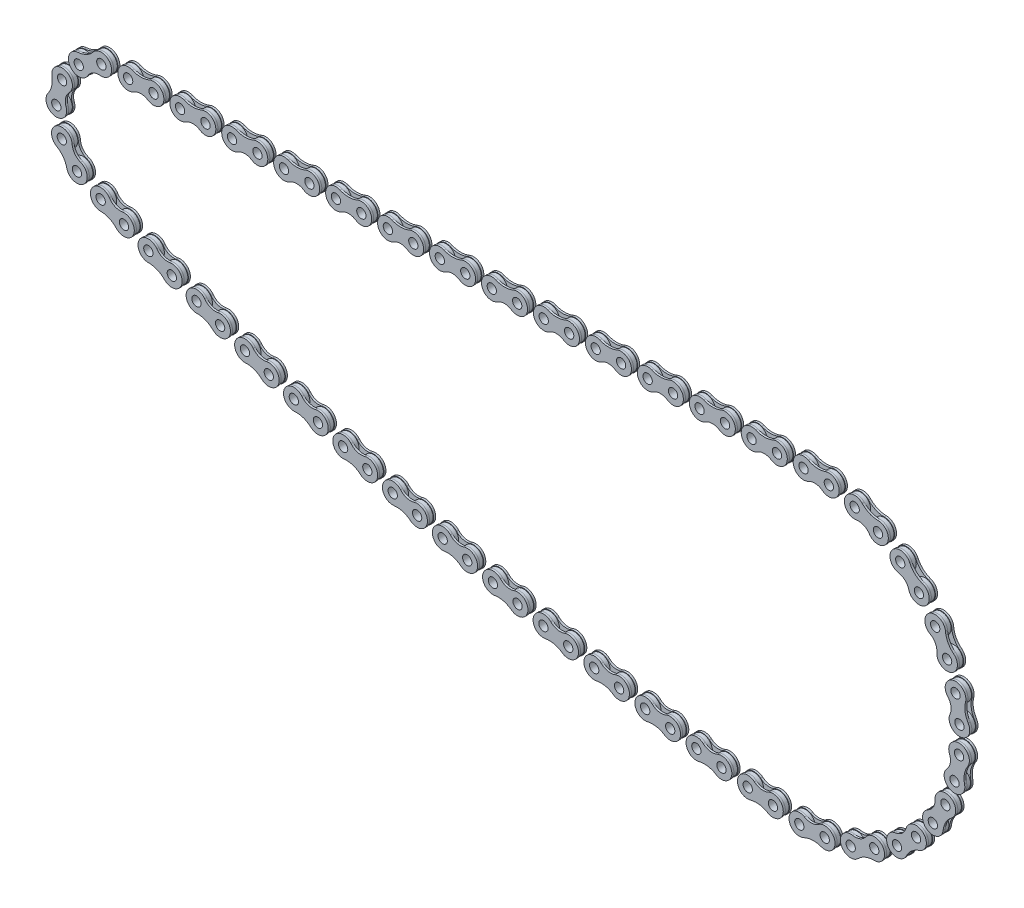
from build123d import *

# Parameters (mm, degrees)
SKETCH1_R             = 4.75
SKETCH1_R_2           = 2.25
BOSS_EXTRUDE1_DEPTH   = 1
BOSS_EXTRUDE1_2_DEPTH = 1
SKETCH3_R             = 2.25
BOSS_EXTRUDE2_DEPTH   = 1
CRVPATTERN1_5_ANGLE   = 4.3505813
CRVPATTERN1_6_ANGLE   = 23.555347
CRVPATTERN1_7_ANGLE   = 42.7601127
CRVPATTERN1_8_ANGLE   = 61.9648784
CRVPATTERN1_9_ANGLE   = 81.1696442
CRVPATTERN1_10_ANGLE  = 100.3744099
CRVPATTERN1_11_ANGLE  = 119.5791756
CRVPATTERN1_12_ANGLE  = 138.7839413
CRVPATTERN1_13_ANGLE  = 157.988707
CRVPATTERN1_14_ANGLE  = 177.1934727
CRVPATTERN1_15_ANGLE  = 172.4142473
CRVPATTERN1_16_ANGLE  = 171.1676379
CRVPATTERN1_17_ANGLE  = 169.9210285
CRVPATTERN1_18_ANGLE  = 168.6744191
CRVPATTERN1_19_ANGLE  = 167.4278097
CRVPATTERN1_20_ANGLE  = 166.1812003
CRVPATTERN1_21_ANGLE  = 164.9345909
CRVPATTERN1_22_ANGLE  = 163.6879815
CRVPATTERN1_23_ANGLE  = 162.4413721
CRVPATTERN1_24_ANGLE  = 161.1947627
CRVPATTERN1_25_ANGLE  = 159.9481533
CRVPATTERN1_26_ANGLE  = 158.7015439
CRVPATTERN1_27_ANGLE  = 157.4549345
CRVPATTERN1_28_ANGLE  = 156.2083251
CRVPATTERN1_29_ANGLE  = 126.4122141
CRVPATTERN1_30_ANGLE  = 76.9153953
CRVPATTERN1_31_ANGLE  = 27.4185764


with BuildPart() as part:
    # Sketch1 → Boss-Extrude1 (new, symmetric)
    with BuildSketch(Plane.XY):
        with Locations((-6.15, 0)):
            Circle(SKETCH1_R)
        with Locations((-6.15, 0)):
            Circle(SKETCH1_R_2, mode=Mode.SUBTRACT)
    extrude(amount=BOSS_EXTRUDE1_DEPTH, both=True)



with BuildPart() as body_2:
    # Sketch1 → Boss-Extrude1 2 (new, symmetric)
    with BuildSketch(Plane.XY):
        with Locations(Location((6.15, 0, 0), (0, 0, 180))):
            Circle(SKETCH1_R)
        with Locations((6.15, 0)):
            Circle(SKETCH1_R_2, mode=Mode.SUBTRACT)
    extrude(amount=BOSS_EXTRUDE1_2_DEPTH, both=True)


with BuildPart() as part_1:
    add(part.part)

    add(body_2.part)  # Boss-Extrude2 merges body 2
    # Sketch3 → Boss-Extrude2 (add)
    with BuildSketch(Plane.XY.offset(1)):
        with BuildLine():
            ThreePointArc((-4.174326828, 4.593116101), (-11.132529303, -0.41761435), (-3.437312133, -4.20015768))
            ThreePointArc((-3.437312133, -4.20015768), (0, -3.186658212), (3.437312133, -4.20015768))
            ThreePointArc((3.437312133, -4.20015768), (11.132529303, -0.41761435), (4.174326828, 4.593116101))
            ThreePointArc((4.174326828, 4.593116101), (0, 3.733426149), (-4.174326828, 4.593116101))
        make_face()
        with Locations((-6.15, 0)):
            Circle(SKETCH3_R, mode=Mode.SUBTRACT)
        with Locations((6.15, 0)):
            Circle(SKETCH3_R, mode=Mode.SUBTRACT)
    extrude(amount=BOSS_EXTRUDE2_DEPTH)

    # Mirror1: part across plane


with BuildPart() as part_2:
    add(part_1.part)
    add(part_1.part.mirror(Plane.XY))


with BuildPart() as body_2_2:
    # CrvPattern1: read off the stored shape, not the designer's step
    # CrvPattern1: copy of part
    add(part_2.part.moved(Location((25.1389795, 0, 0))))


with BuildPart() as body_3:
    # CrvPattern1 2: copy of part
    add(part_2.part.moved(Location((50.2779591, 0, 0))))


with BuildPart() as body_4:
    # CrvPattern1 3: copy of part
    add(part_2.part.moved(Location((75.4169386, 0, 0))))


with BuildPart() as body_5:
    # CrvPattern1 4: copy of part
    add(part_2.part.moved(Location((100.5559181, 0, 0))))


with BuildPart() as body_6:
    # CrvPattern1 5: copy of part
    add(part_2.part.moved(Location((125.3389364, 9.3190121, 0))).rotate(Axis((0, 0, 0), (0, 0, -1)), CRVPATTERN1_5_ANGLE))


with BuildPart() as body_7:
    # CrvPattern1 6: copy of part
    add(part_2.part.moved(Location((139.9486935, 54.2004048, 0))).rotate(Axis((0, 0, 0), (0, 0, -1)), CRVPATTERN1_6_ANGLE))


with BuildPart() as body_8:
    # CrvPattern1 7: copy of part
    add(part_2.part.moved(Location((138.9818847, 101.389913, 0))).rotate(Axis((0, 0, 0), (0, 0, -1)), CRVPATTERN1_7_ANGLE))


with BuildPart() as body_9:
    # CrvPattern1 8: copy of part
    add(part_2.part.moved(Location((122.5461177, 145.6352515, 0))).rotate(Axis((0, 0, 0), (0, 0, -1)), CRVPATTERN1_8_ANGLE))


with BuildPart() as body_10:
    # CrvPattern1 9: copy of part
    add(part_2.part.moved(Location((92.4707258, 182.0118265, 0))).rotate(Axis((0, 0, 0), (0, 0, -1)), CRVPATTERN1_9_ANGLE))


with BuildPart() as body_11:
    # CrvPattern1 10: copy of part
    add(part_2.part.moved(Location((52.1031595, 206.4708535, 0))).rotate(Axis((0, 0, 0), (0, 0, -1)), CRVPATTERN1_10_ANGLE))


with BuildPart() as body_12:
    # CrvPattern1 11: copy of part
    add(part_2.part.moved(Location((5.9364087, 216.2899946, 0))).rotate(Axis((0, 0, 0), (0, 0, -1)), CRVPATTERN1_11_ANGLE))


with BuildPart() as body_13:
    # CrvPattern1 12: copy of part
    add(part_2.part.moved(Location((-40.8910761, 210.3763598, 0))).rotate(Axis((0, 0, 0), (0, 0, -1)), CRVPATTERN1_12_ANGLE))


with BuildPart() as body_14:
    # CrvPattern1 13: copy of part
    add(part_2.part.moved(Location((-83.1673033, 189.3881485, 0))).rotate(Axis((0, 0, 0), (0, 0, -1)), CRVPATTERN1_13_ANGLE))


with BuildPart() as body_15:
    # CrvPattern1 14: copy of part
    add(part_2.part.moved(Location((-116.1868456, 155.66139, 0))).rotate(Axis((0, 0, 0), (0, 0, -1)), CRVPATTERN1_14_ANGLE))


with BuildPart() as body_16:
    # CrvPattern1 15: copy of part
    add(part_2.part.moved(Location((-117.3070452, 133.4402121, 0))).rotate(Axis((0, 0, 0), (0, 0, 1)), CRVPATTERN1_15_ANGLE))


with BuildPart() as body_17:
    # CrvPattern1 16: copy of part
    add(part_2.part.moved(Location((-95.0467252, 131.129984, 0))).rotate(Axis((0, 0, 0), (0, 0, 1)), CRVPATTERN1_16_ANGLE))


with BuildPart() as body_18:
    # CrvPattern1 17: copy of part
    add(part_2.part.moved(Location((-72.7414132, 129.3045919, 0))).rotate(Axis((0, 0, 0), (0, 0, 1)), CRVPATTERN1_17_ANGLE))


with BuildPart() as body_19:
    # CrvPattern1 18: copy of part
    add(part_2.part.moved(Location((-50.4016677, 127.9649, 0))).rotate(Axis((0, 0, 0), (0, 0, 1)), CRVPATTERN1_18_ANGLE))


with BuildPart() as body_20:
    # CrvPattern1 19: copy of part
    add(part_2.part.moved(Location((-28.0380638, 127.1115426, 0))).rotate(Axis((0, 0, 0), (0, 0, 1)), CRVPATTERN1_19_ANGLE))


with BuildPart() as body_21:
    # CrvPattern1 20: copy of part
    add(part_2.part.moved(Location((-5.6611875, 126.7449234, 0))).rotate(Axis((0, 0, 0), (0, 0, 1)), CRVPATTERN1_20_ANGLE))


with BuildPart() as body_22:
    # CrvPattern1 21: copy of part
    add(part_2.part.moved(Location((16.7183685, 126.8652161, 0))).rotate(Axis((0, 0, 0), (0, 0, 1)), CRVPATTERN1_21_ANGLE))


with BuildPart() as body_23:
    # CrvPattern1 22: copy of part
    add(part_2.part.moved(Location((39.0900107, 127.4723638, 0))).rotate(Axis((0, 0, 0), (0, 0, 1)), CRVPATTERN1_22_ANGLE))


with BuildPart() as body_24:
    # CrvPattern1 23: copy of part
    add(part_2.part.moved(Location((61.4431489, 128.5660789, 0))).rotate(Axis((0, 0, 0), (0, 0, 1)), CRVPATTERN1_23_ANGLE))


with BuildPart() as body_25:
    # CrvPattern1 24: copy of part
    add(part_2.part.moved(Location((83.7672019, 130.1458439, 0))).rotate(Axis((0, 0, 0), (0, 0, 1)), CRVPATTERN1_24_ANGLE))


with BuildPart() as body_26:
    # CrvPattern1 25: copy of part
    add(part_2.part.moved(Location((106.0516022, 132.2109108, 0))).rotate(Axis((0, 0, 0), (0, 0, 1)), CRVPATTERN1_25_ANGLE))


with BuildPart() as body_27:
    # CrvPattern1 26: copy of part
    add(part_2.part.moved(Location((128.2858012, 134.7603022, 0))).rotate(Axis((0, 0, 0), (0, 0, 1)), CRVPATTERN1_26_ANGLE))


with BuildPart() as body_28:
    # CrvPattern1 27: copy of part
    add(part_2.part.moved(Location((150.4592738, 137.7928112, 0))).rotate(Axis((0, 0, 0), (0, 0, 1)), CRVPATTERN1_27_ANGLE))


with BuildPart() as body_29:
    # CrvPattern1 28: copy of part
    add(part_2.part.moved(Location((172.561524, 141.3070024, 0))).rotate(Axis((0, 0, 0), (0, 0, 1)), CRVPATTERN1_28_ANGLE))


with BuildPart() as body_30:
    # CrvPattern1 29: copy of part
    add(part_2.part.moved(Location((102.6655065, 217.1467487, 0))).rotate(Axis((0, 0, 0), (0, 0, 1)), CRVPATTERN1_29_ANGLE))


with BuildPart() as body_31:
    # CrvPattern1 30: copy of part
    add(part_2.part.moved(Location((-76.3521189, 229.2765008, 0))).rotate(Axis((0, 0, 0), (0, 0, 1)), CRVPATTERN1_30_ANGLE))


with BuildPart() as body_32:
    # CrvPattern1 31: copy of part
    add(part_2.part.moved(Location((-201.8454226, 101.0350418, 0))).rotate(Axis((0, 0, 0), (0, 0, 1)), CRVPATTERN1_31_ANGLE))


with BuildPart() as body_33:
    # CrvPattern1 32: copy of part
    add(part_2.part.moved(Location((-201.1118362, 0, 0))))


with BuildPart() as body_34:
    # CrvPattern1 33: copy of part
    add(part_2.part.moved(Location((-175.9728567, 0, 0))))


with BuildPart() as body_35:
    # CrvPattern1 34: copy of part
    add(part_2.part.moved(Location((-150.8338772, 0, 0))))


with BuildPart() as body_36:
    # CrvPattern1 35: copy of part
    add(part_2.part.moved(Location((-125.6948976, 0, 0))))


with BuildPart() as body_37:
    # CrvPattern1 36: copy of part
    add(part_2.part.moved(Location((-100.5559181, 0, 0))))


with BuildPart() as body_38:
    # CrvPattern1 37: copy of part
    add(part_2.part.moved(Location((-75.4169386, 0, 0))))


with BuildPart() as body_39:
    # CrvPattern1 38: copy of part
    add(part_2.part.moved(Location((-50.2779591, 0, 0))))


with BuildPart() as body_40:
    # CrvPattern1 39: copy of part
    add(part_2.part.moved(Location((-25.1389795, 0, 0))))


solid = Compound([part_2.part, body_2_2.part, body_3.part, body_4.part, body_5.part, body_6.part, body_7.part, body_8.part, body_9.part, body_10.part, body_11.part, body_12.part, body_13.part, body_14.part, body_15.part, body_16.part, body_17.part, body_18.part, body_19.part, body_20.part, body_21.part, body_22.part, body_23.part, body_24.part, body_25.part, body_26.part, body_27.part, body_28.part, body_29.part, body_30.part, body_31.part, body_32.part, body_33.part, body_34.part, body_35.part, body_36.part, body_37.part, body_38.part, body_39.part, body_40.part])
